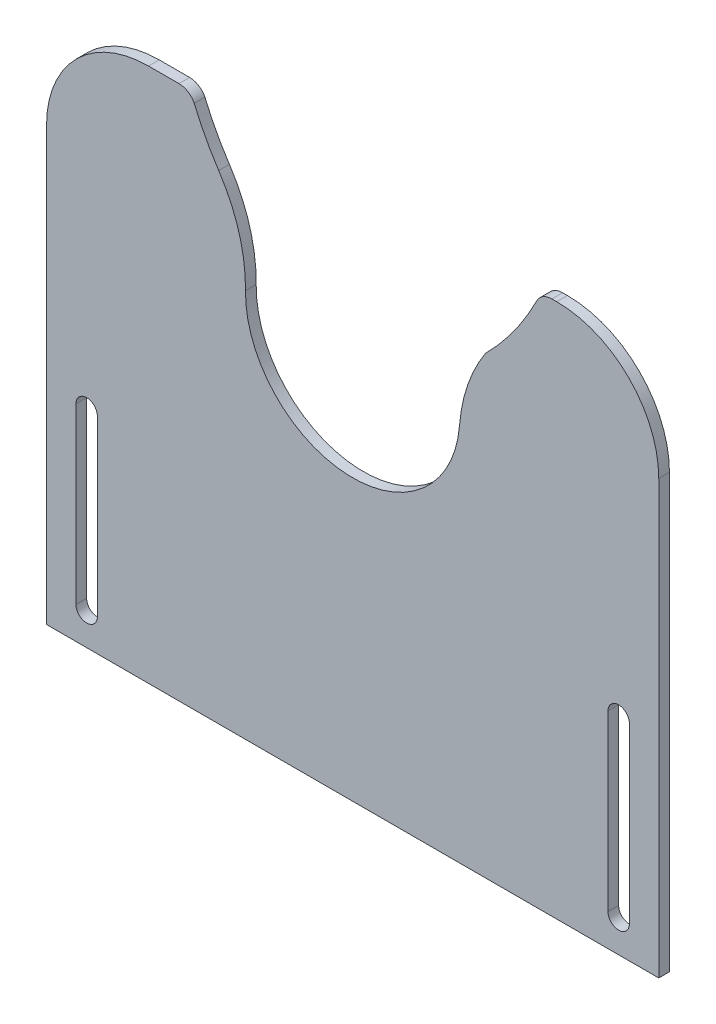
from build123d import *

# Parameters (mm, degrees)
BOSS_EXTRUDE1_DEPTH = 4
CUT_EXTRUDE1_DEPTH  = 10
SKETCH6_R           = 40.091527734
CUT_EXTRUDE2_DEPTH  = 4
FILLET1_START       = -1
FILLET1_DEPTH       = 6


with BuildPart() as part:
    # Sketch1 → Boss-Extrude1 (new body)
    with BuildSketch(Plane.XY):
        with BuildLine():
            Line((76.333328469, 66.289722012), (74.505251863, 66.289722012))
            ThreePointArc((74.505251863, 66.289722012), (71.161019545, 65.339696261), (68.815702909, 62.773389851))
            ThreePointArc((68.815702909, 62.773389851), (60.349327785, 48.779313667), (49.750676494, 36.322096209))
            ThreePointArc((49.750676494, 36.322096209), (34.635353478, 21.965885228), (23.967617679, 4.055742947))
            ThreePointArc((23.967617679, 4.055742947), (14.404733147, -9.267078846), (-1.356711824, -13.797331986))
            ThreePointArc((-1.356711824, -13.797331986), (-15.492367955, -8.455246222), (-23.967617153, 4.055741173))
            ThreePointArc((-23.967617153, 4.055741173), (-31.555286979, 21.388261286), (-43.172925895, 36.322097125))
            ThreePointArc((-43.172925895, 36.322097125), (-52.235366406, 48.931803578), (-59.274045863, 62.773390061))
            ThreePointArc((-59.274045863, 62.773390061), (-61.619362494, 65.339696323), (-64.963594711, 66.289722012))
            Line((-64.963594711, 66.289722012), (-76.333336807, 66.289722012))
            ThreePointArc((-76.333336807, 66.289722012), (-103.321243377, 55.110962932), (-114.5, 28.123055345))
            Line((-114.5, 28.123055345), (-114.5, -133.710277988))
            Line((-114.5, -133.710277988), (114.5, -133.710277988))
            Line((114.5, -133.710277988), (114.5, 28.123055345))
            ThreePointArc((114.5, 28.123055345), (103.321240429, 55.11096588), (76.333328469, 66.289722012))
        make_face()
    extrude(amount=BOSS_EXTRUDE1_DEPTH)

    # Sketch2 → Cut-Extrude1 (cut)
    with BuildSketch(Plane.XY.offset(4)):
        with BuildLine():
            Line((-95.500001569, -56.710277988), (-95.500001569, -121.710277988))
            ThreePointArc((-95.500001569, -121.710277988), (-99.500001569, -125.710277988), (-103.500001569, -121.710277988))
            Line((-103.500001569, -121.710277988), (-103.500001569, -56.710277988))
            ThreePointArc((-103.500001569, -56.710277988), (-99.500001569, -52.710277988), (-95.500001569, -56.710277988))
        make_face()
        with BuildLine():
            Line((95.500001569, -56.710277988), (95.500001569, -121.710277988))
            ThreePointArc((95.500001569, -121.710277988), (99.500001569, -125.710277988), (103.500001569, -121.710277988))
            Line((103.500001569, -121.710277988), (103.500001569, -56.710277988))
            ThreePointArc((103.500001569, -56.710277988), (99.500001569, -52.710277988), (95.500001569, -56.710277988))
        make_face()
    extrude(amount=-CUT_EXTRUDE1_DEPTH, mode=Mode.SUBTRACT)

    # Sketch6 → Cut-Extrude2 (cut)
    with BuildSketch(Plane.XY.offset(4)):
        with Locations((-1.216e-06, 11.16582753)):
            Circle(SKETCH6_R)
    extrude(amount=-CUT_EXTRUDE2_DEPTH, mode=Mode.SUBTRACT)

    # Fillet1: read off the stored shape, not the designer's step
    # Fillet1 outline → Fillet1 (cut)
    with BuildSketch(Plane.XY.offset(FILLET1_START)):
        with BuildLine():
            ThreePointArc((-43.172925895, 36.322097125), (-46.764931779, 40.845410754), (-50.094550883, 45.56521044))
            ThreePointArc((-50.094550883, 45.56521044), (-42.536890866, 29.36311637), (-40.088563254, 11.653464507))
            ThreePointArc((-40.088563254, 11.653464507), (-39.059263062, 20.20489054), (-36.227182581, 28.339118606))
            ThreePointArc((-36.227182581, 28.339118606), (-39.561558424, 32.4511088), (-43.172925895, 36.322097125))
        make_face()
        with BuildLine():
            ThreePointArc((37.500310301, 25.345292688), (39.69442098, 16.794632252), (39.964034241, 7.971071505))
            ThreePointArc((39.964034241, 7.971071505), (43.057284902, 22.767959834), (49.750676494, 36.322096209))
            ThreePointArc((49.750676494, 36.322096209), (43.328961969, 31.16463037), (37.500310301, 25.345292688))
        make_face()
    extrude(amount=FILLET1_DEPTH, mode=Mode.SUBTRACT)


solid = part.part
